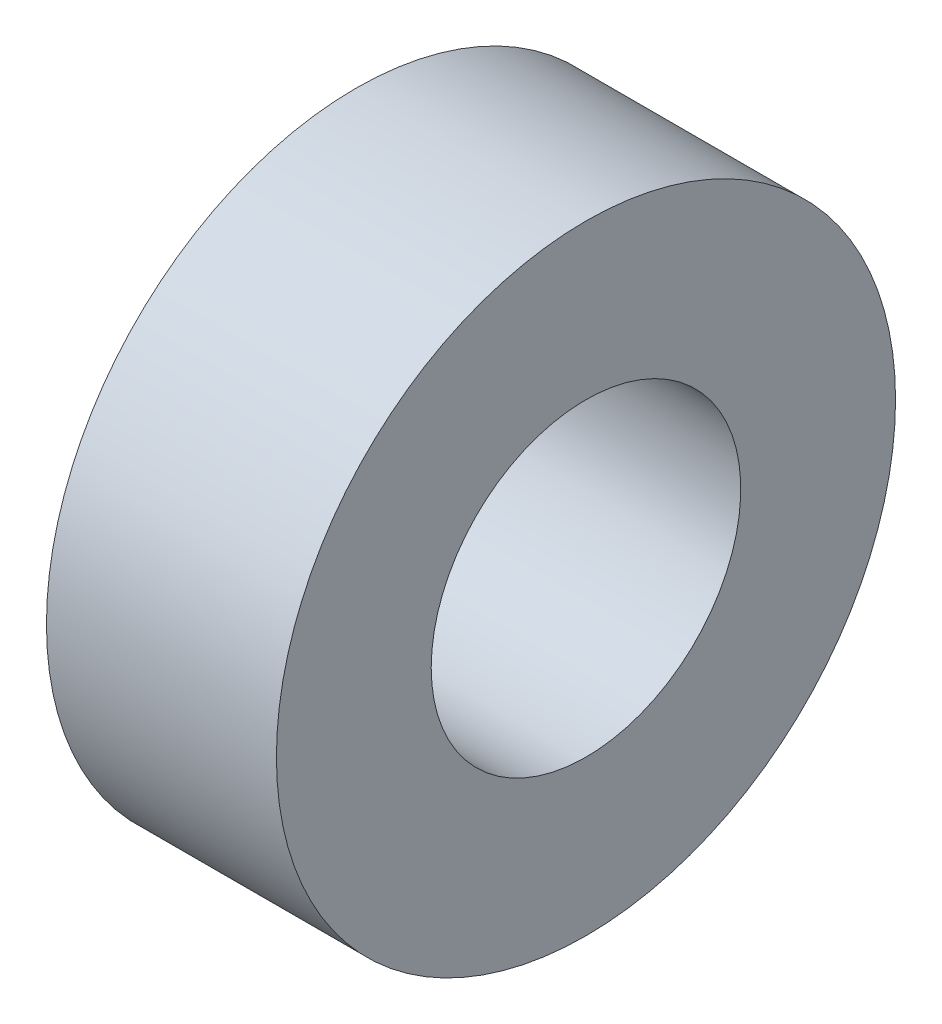
from build123d import *

# Parameters (mm, degrees)
SKETCH15_W   = 26
SKETCH15_H   = 35
SKETCH16_W   = 26
SKETCH16_H   = 17.5
SCALE1_SCALE = 0.1


with BuildPart() as part:
    # Sketch15 → Revolve1 (revolve)
    with BuildSketch(Plane.XY):
        with Locations((864, 1478.5)):
            Rectangle(SKETCH15_W, SKETCH15_H)
    revolve(axis=Axis((851, 1461, 0), (1, 0, 0)))

    # Sketch16 → Cut-Revolve1 (revolve, cut)
    with BuildSketch(Plane.XY):
        with Locations((864, 1469.75)):
            Rectangle(SKETCH16_W, SKETCH16_H)
    revolve(axis=Axis((851, 1461, 0), (1, 0, 0)), mode=Mode.SUBTRACT)


with BuildPart() as part_1:
    # Scale1: scaled about (0, 0, 0)
    add(part.part.scale(SCALE1_SCALE))


solid = part_1.part
